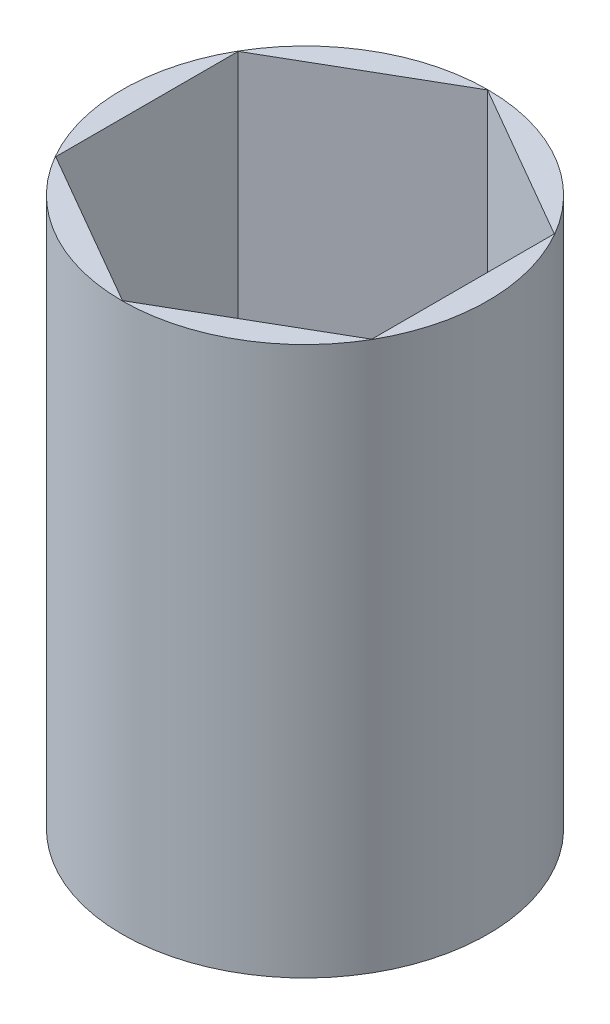
from build123d import *

# Parameters (mm, degrees)
SKETCH1_R           = 7
BOSS_EXTRUDE1_DEPTH = 20
BOSS_EXTRUDE2_START = 1
SKETCH2_R           = 7
SKETCH2_R_2         = 2.05
BOSS_EXTRUDE2_DEPTH = 1


with BuildPart() as part:
    # Sketch1 → Boss-Extrude1 (new body)
    with BuildSketch(Plane(origin=(0, 0, 0), x_dir=(1, 0, 0), z_dir=(0, 1, 0))):
        Circle(SKETCH1_R)
        Polygon((0, 6.985938257), (-6.05, 3.492969129), (-6.05, -3.492969129), (0, -6.985938257), (6.05, -3.492969129), (6.05, 3.492969129), align=None, mode=Mode.SUBTRACT)
    extrude(amount=BOSS_EXTRUDE1_DEPTH)

    # Sketch2 → Boss-Extrude2 (add)
    with BuildSketch(Plane.XZ.offset(BOSS_EXTRUDE2_START)):
        Circle(SKETCH2_R)
        Circle(SKETCH2_R_2, mode=Mode.SUBTRACT)
    extrude(amount=-BOSS_EXTRUDE2_DEPTH)


solid = part.part
